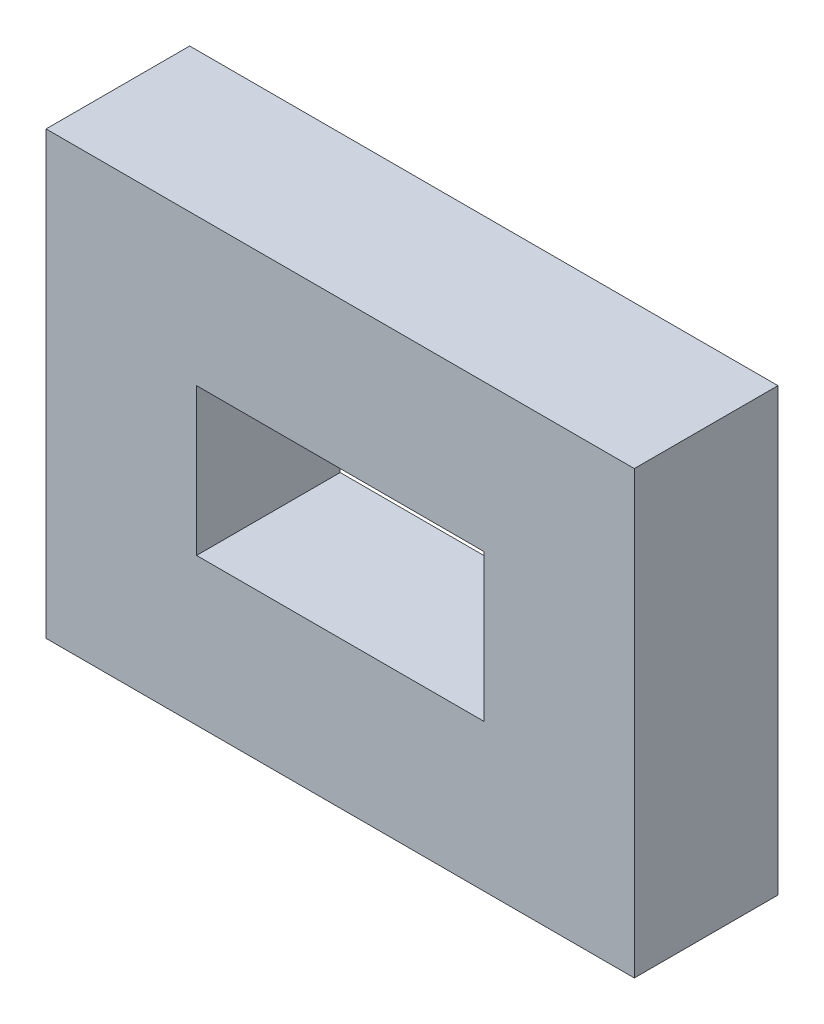
from build123d import *

# Parameters (mm, degrees)
SKETCH1_W           = 20.32
SKETCH1_H           = 15.24
BOSS_EXTRUDE1_DEPTH = 4.9609375
CAVITY1_START       = -4.9609375
CAVITY1_OUTLINE_W   = 5.08
CAVITY1_OUTLINE_H   = 4.9609375
CAVITY1_DEPTH       = 9.921875


# Read off the part's stored shape, not the designer's step: Cavity1
with BuildPart() as part:
    # Sketch1 → Boss-Extrude1 (new body)
    with BuildSketch(Plane.XY):
        Rectangle(SKETCH1_W, SKETCH1_H)
    extrude(amount=BOSS_EXTRUDE1_DEPTH)

    # Cavity1 outline → Cavity1 (cut)
    with BuildSketch(Plane.YZ.offset(CAVITY1_START)):
        with Locations((0, 2.48046875)):
            Rectangle(CAVITY1_OUTLINE_W, CAVITY1_OUTLINE_H)
    extrude(amount=CAVITY1_DEPTH, mode=Mode.SUBTRACT)


solid = part.part
